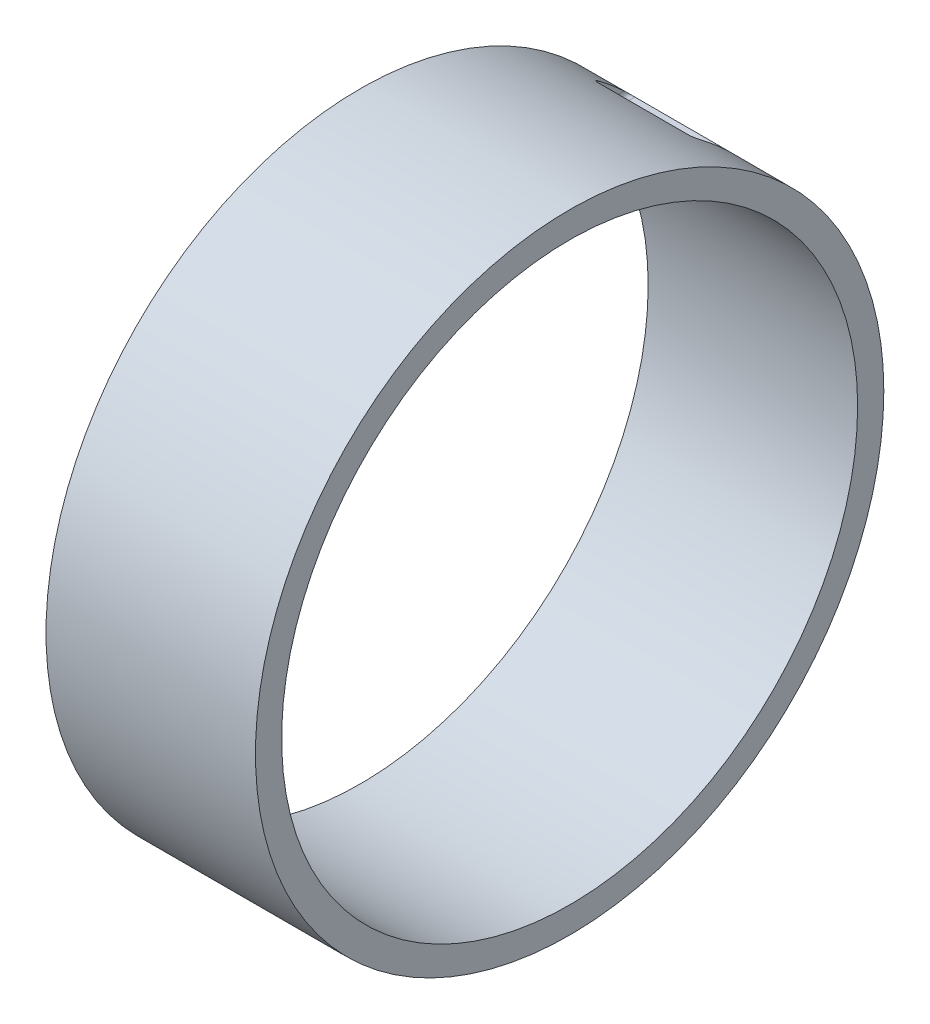
from build123d import *

# Parameters (mm, degrees)
SKETCH1_R               = 76.2
SKETCH1_R_2             = 69.85
BOSS_EXTRUDE1_DEPTH     = 25.4
CUT_EXTRUDE1_REACH      = 112.716
CUT_EXTRUDE1_END_RADIUS = 76.2
SKETCH4_W               = 24.638
SKETCH4_H               = 7.62
FILLET1_R               = 1.27


with BuildPart() as part:
    # Sketch1 → Boss-Extrude1 (new, symmetric)
    with BuildSketch(Plane(origin=(0, 0, 0), x_dir=(0, 0, -1), z_dir=(1, 0, 0))):
        Circle(SKETCH1_R)
        Circle(SKETCH1_R_2, mode=Mode.SUBTRACT)
    extrude(amount=BOSS_EXTRUDE1_DEPTH, both=True)

    # Cut-Extrude1: up to this cylinder (the profile starts inside it)
    cut_extrude1_end = Plane(origin=(-1.143, 0, 0), z_dir=(-1, 0, 0)) * Cylinder(CUT_EXTRUDE1_END_RADIUS, 378.832, mode=Mode.PRIVATE)
    # Sketch4 → Cut-Extrude1 (cut, up to the surface)
    with BuildSketch(Plane.XY, mode=Mode.PRIVATE) as cut_extrude1_sk1:
        with Locations((-1.143, 58.166)):
            Rectangle(SKETCH4_W, SKETCH4_H)
    cut_extrude1_tool1 = extrude(cut_extrude1_sk1.sketch, amount=-CUT_EXTRUDE1_REACH, mode=Mode.PRIVATE) & cut_extrude1_end
    add(cut_extrude1_tool1.solids().sort_by_distance((-1.143, 58.166, 0))[0], mode=Mode.SUBTRACT)

    # Fillet1
    fillet1_edges = [part.edges().sort_by_distance(p)[0] for p in [
        (-13.462, 54.356, -48.635693186),
        (-13.462, 61.976, -38.275490602),
        (11.176, 61.976, -38.275490602),
        (11.176, 54.356, -48.635693186),
    ]]
    fillet(fillet1_edges, radius=FILLET1_R)


solid = part.part
